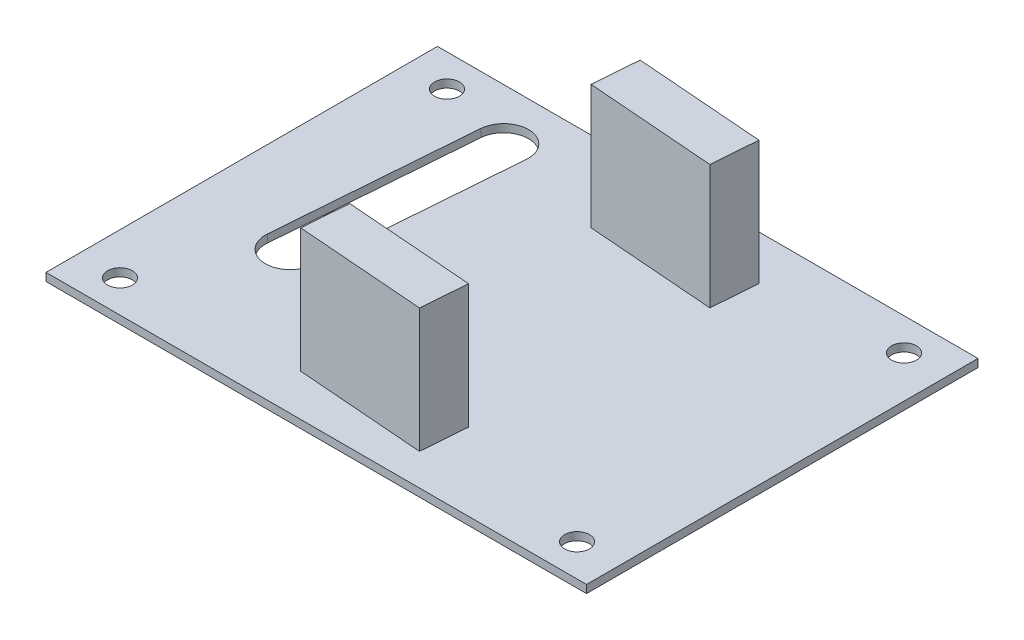
from build123d import *

# Parameters (mm, degrees)
IZIM1_W                     = 54.4
IZIM1_H                     = 39.4
Y_KSEKLIK_EKSTR_ZYON1_DEPTH = 0.8
IZIM2_R                     = 1.25
KES_EKSTR_ZYON1_DEPTH       = 68.174102153
Y_KSEKLIK_EKSTR_ZYON2_DEPTH = 12.5
KES_EKSTR_ZYON2_DEPTH       = 69.322543864


with BuildPart() as part:
    # Çizim1 → Yükseklik-Ekstrüzyon1 (new body)
    with BuildSketch(Plane(origin=(0, 0, 0), x_dir=(1, 0, 0), z_dir=(0, 1, 0))):
        with Locations((27.2, 19.7)):
            Rectangle(IZIM1_W, IZIM1_H)
    extrude(amount=Y_KSEKLIK_EKSTR_ZYON1_DEPTH)

    # Çizim2 → Kes-Ekstrüzyon1 (cut, through all)
    with BuildSketch(Plane(origin=(0, 0.8, 0), x_dir=(1, 0, 0), z_dir=(0, 1, 0))):
        with Locations((4.2, 36.1545455)):
            Circle(IZIM2_R)
        with Locations((50.2, 36.1545455)):
            Circle(IZIM2_R)
        with Locations((4.2, 3.2454545)):
            Circle(IZIM2_R)
        with Locations((50.2, 3.2454545)):
            Circle(IZIM2_R)
    extrude(amount=-KES_EKSTR_ZYON1_DEPTH, mode=Mode.SUBTRACT)

    # Çizim3 → Yükseklik-Ekstrüzyon2 (add)
    with BuildSketch(Plane(origin=(0, 0.8, 0), x_dir=(1, 0, 0), z_dir=(0, 1, 0))):
        Polygon((36.499431565, 30.311930671), (36.855540949, 34.898125838), (23.894554609, 35.904521923), (23.538445224, 31.318326757), align=None)
        Polygon((21.432754953, 4.199955337), (34.393741294, 3.193559251), (34.749850678, 7.779754418), (21.788864337, 8.786150503), align=None)
    extrude(amount=Y_KSEKLIK_EKSTR_ZYON2_DEPTH)

    # Çizim3<3> → Kes-Ekstrüzyon2 (cut, through all)
    with BuildSketch(Plane(origin=(0, 0.8, 0), x_dir=(1, 0, 0), z_dir=(0, 1, 0))):
        with BuildLine():
            Line((9.336490522, 34.427101858), (7.788188852, 14.487122872))
            ThreePointArc((7.788188852, 14.487122872), (10.087148516, 11.80108779), (12.773183598, 14.100047455))
            Line((12.773183598, 14.100047455), (14.321485268, 34.04002644))
            ThreePointArc((14.321485268, 34.04002644), (12.022525604, 36.726061522), (9.336490522, 34.427101858))
        make_face()
    extrude(amount=-KES_EKSTR_ZYON2_DEPTH, mode=Mode.SUBTRACT)


solid = part.part
